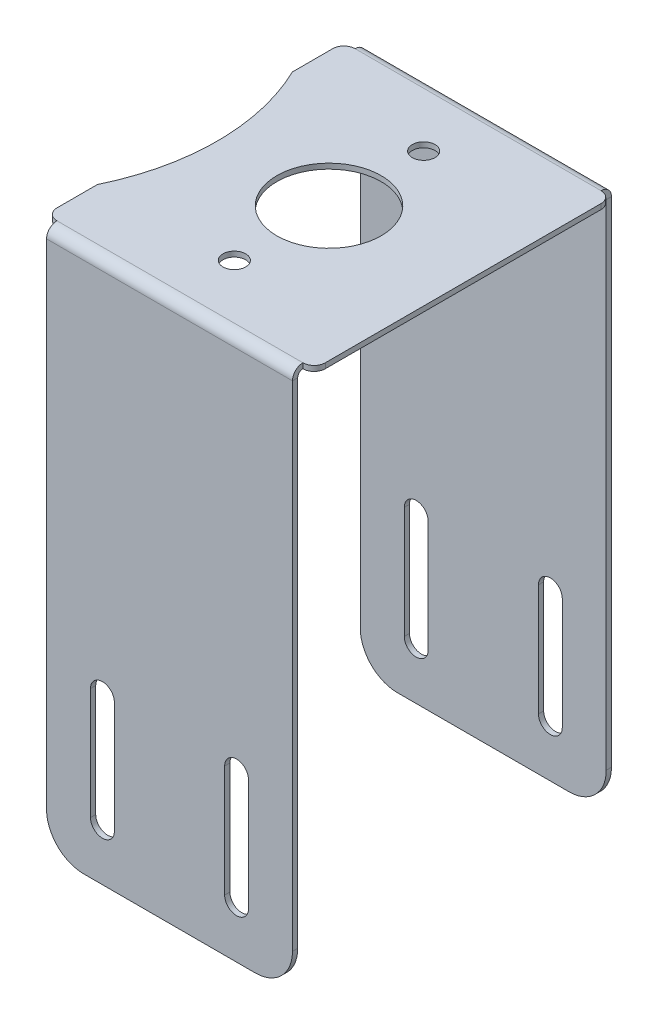
from build123d import *

# Parameters (mm, degrees)
SKETCH1_W               = 36
SKETCH1_H               = 40
BASE_FLANGE1_DEPTH      = 0.7
EDGE_FLANGE1_DEPTH      = 33
EDGE_FLANGE1_BEND_DEPTH = 33
BREAK_CORNER1_START     = -0.7
BREAK_CORNER1_DEPTH     = 0.7
BREAK_CORNER2_START     = -21.4
BREAK_CORNER2_DEPTH     = 42.8
CUT_EXTRUDE1_DEPTH      = 78.892554201
CUT_EXTRUDE1_DEPTH_BACK = 78.892554201
CUT_EXTRUDE2_REACH      = 79.893
SKETCH11_R              = 7
SKETCH11_R_2            = 1.525
CUT_EXTRUDE3_REACH      = 79.893
SKETCH12_R              = 30


# Read off the part's stored shape, not the designer's step: Break-Corner1, Break-Corner2
# Sheet-metal steps are written as plain solids
with BuildPart() as part:
    # Sketch1 → Base-Flange1 (new body)
    with BuildSketch(Plane(origin=(0, 0, 0), x_dir=(1, 0, 0), z_dir=(0, 1, 0))):
        Rectangle(SKETCH1_W, SKETCH1_H)
    extrude(amount=-BASE_FLANGE1_DEPTH)

    # Edge-Flange1 section (across the edge) → Edge-Flange1 (add)
    with BuildSketch(Plane(origin=(16.5, -0.7, 20.7), x_dir=(0, 0, -1), z_dir=(-1, 0, 0))):
        with BuildLine():
            Line((-0.7, 0.7), (-0.7, 72))
            Line((-0.7, 72), (0, 72))
            Line((0, 72), (0, 0.7))
            ThreePointArc((0, 0.7), (0.205025253, 0.205025253), (0.7, 0))
            Line((0.7, 0), (0.7, -0.7))
            ThreePointArc((0.7, -0.7), (-0.289949494, -0.289949494), (-0.7, 0.7))
        make_face()
    extrude(amount=EDGE_FLANGE1_DEPTH)

    # Edge-Flange1 section 2 (across the edge) → Edge-Flange1 bend (add)
    with BuildSketch(Plane(origin=(-16.5, -0.7, -20.7), x_dir=(0, 0, 1), z_dir=(1, 0, 0))):
        with BuildLine():
            Line((-0.7, 0.7), (-0.7, 72))
            Line((-0.7, 72), (0, 72))
            Line((0, 72), (0, 0.7))
            ThreePointArc((0, 0.7), (0.205025253, 0.205025253), (0.7, 0))
            Line((0.7, 0), (0.7, -0.7))
            ThreePointArc((0.7, -0.7), (-0.289949494, -0.289949494), (-0.7, 0.7))
        make_face()
    extrude(amount=EDGE_FLANGE1_BEND_DEPTH)

    # Break-Corner1 outline → Break-Corner1 (cut)
    with BuildSketch(Plane(origin=(0, 0, 0), x_dir=(1, 0, 0), z_dir=(0, 1, 0)).offset(BREAK_CORNER1_START)):
        with BuildLine():
            Line((18, -20), (18, -18.5001))
            ThreePointArc((18, -18.5001), (17.560689461, -19.560689461), (16.5001, -20))
            Line((16.5001, -20), (18, -20))
        make_face()
        with BuildLine():
            ThreePointArc((16.5001, 20), (17.560689461, 19.560689461), (18, 18.5001))
            Line((18, 18.5001), (18, 20))
            Line((18, 20), (16.5001, 20))
        make_face()
        with BuildLine():
            ThreePointArc((-16.5001, -20), (-17.560689461, -19.560689461), (-18, -18.5001))
            Line((-18, -18.5001), (-18, -20))
            Line((-18, -20), (-16.5001, -20))
        make_face()
        with BuildLine():
            ThreePointArc((-18, 18.5001), (-17.560689461, 19.560689461), (-16.5001, 20))
            Line((-16.5001, 20), (-18, 20))
            Line((-18, 20), (-18, 18.5001))
        make_face()
    extrude(amount=BREAK_CORNER1_DEPTH, mode=Mode.SUBTRACT)

    # Break-Corner2 outline → Break-Corner2 (cut)
    with BuildSketch(Plane.XY.offset(BREAK_CORNER2_START)):
        with BuildLine():
            ThreePointArc((16.5, -67.7), (15.035533906, -71.235533906), (11.5, -72.7))
            Line((11.5, -72.7), (16.5, -72.7))
            Line((16.5, -72.7), (16.5, -67.7))
        make_face()
        with BuildLine():
            Line((-16.5, -72.7), (-11.5, -72.7))
            ThreePointArc((-11.5, -72.7), (-15.035533906, -71.235533906), (-16.5, -67.7))
            Line((-16.5, -67.7), (-16.5, -72.7))
        make_face()
    extrude(amount=BREAK_CORNER2_DEPTH, mode=Mode.SUBTRACT)

    # Sketch10 → Cut-Extrude1 (cut, two sides: drawn at the far end of the back side and taken through both)
    with BuildSketch(Plane.XY.offset(-CUT_EXTRUDE1_DEPTH_BACK)):
        with BuildLine():
            Line((-7.4, -50.7), (-7.4, -65.7))
            ThreePointArc((-7.4, -65.7), (-9, -67.3), (-10.6, -65.7))
            Line((-10.6, -65.7), (-10.6, -50.7))
            ThreePointArc((-10.6, -50.7), (-9, -49.1), (-7.4, -50.7))
        make_face()
        with BuildLine():
            Line((7.4, -50.7), (7.4, -65.7))
            ThreePointArc((7.4, -65.7), (9, -67.3), (10.6, -65.7))
            Line((10.6, -65.7), (10.6, -50.7))
            ThreePointArc((10.6, -50.7), (9, -49.1), (7.4, -50.7))
        make_face()
    extrude(amount=CUT_EXTRUDE1_DEPTH + CUT_EXTRUDE1_DEPTH_BACK, mode=Mode.SUBTRACT)

    # Sketch11 → Cut-Extrude2 (cut, up to next)
    with BuildSketch(Plane(origin=(0, 0, 0), x_dir=(1, 0, 0), z_dir=(0, 1, 0)), mode=Mode.PRIVATE) as cut_extrude2_sk1:
        with Locations(Location((0, 0, 0), (0, 0, 270))):
            Circle(SKETCH11_R)
    cut_extrude2_tool1 = extrude(cut_extrude2_sk1.sketch, amount=-CUT_EXTRUDE2_REACH, mode=Mode.PRIVATE) & part.part
    # Sketch11 → Cut-Extrude2 (cut, up to next)
    with BuildSketch(Plane(origin=(0, 0, 0), x_dir=(1, 0, 0), z_dir=(0, 1, 0)), mode=Mode.PRIVATE) as cut_extrude2_sk2:
        with Locations(Location((0, -12.7, 0), (0, 0, 270))):
            Circle(SKETCH11_R_2)
    cut_extrude2_tool2 = extrude(cut_extrude2_sk2.sketch, amount=-CUT_EXTRUDE2_REACH, mode=Mode.PRIVATE) & part.part
    # Sketch11 → Cut-Extrude2 (cut, up to next)
    with BuildSketch(Plane(origin=(0, 0, 0), x_dir=(1, 0, 0), z_dir=(0, 1, 0)), mode=Mode.PRIVATE) as cut_extrude2_sk3:
        with Locations(Location((0, 12.7, 0), (0, 0, 270))):
            Circle(SKETCH11_R_2)
    cut_extrude2_tool3 = extrude(cut_extrude2_sk3.sketch, amount=-CUT_EXTRUDE2_REACH, mode=Mode.PRIVATE) & part.part
    add(cut_extrude2_tool1.solids().sort_by_distance((0, 0, 0))[0], mode=Mode.SUBTRACT)
    add(cut_extrude2_tool2.solids().sort_by_distance((0, 0, 12.7))[0], mode=Mode.SUBTRACT)
    add(cut_extrude2_tool3.solids().sort_by_distance((0, 0, -12.7))[0], mode=Mode.SUBTRACT)

    # Sketch12 → Cut-Extrude3 (cut, up to next)
    with BuildSketch(Plane(origin=(0, 0, 0), x_dir=(1, 0, 0), z_dir=(0, 1, 0)), mode=Mode.PRIVATE) as cut_extrude3_sk1:
        with Locations((-45, 0)):
            Circle(SKETCH12_R)
    cut_extrude3_tool1 = extrude(cut_extrude3_sk1.sketch, amount=-CUT_EXTRUDE3_REACH, mode=Mode.PRIVATE) & part.part
    add(cut_extrude3_tool1.solids().sort_by_distance((-45, 0, 0))[0], mode=Mode.SUBTRACT)


solid = part.part
